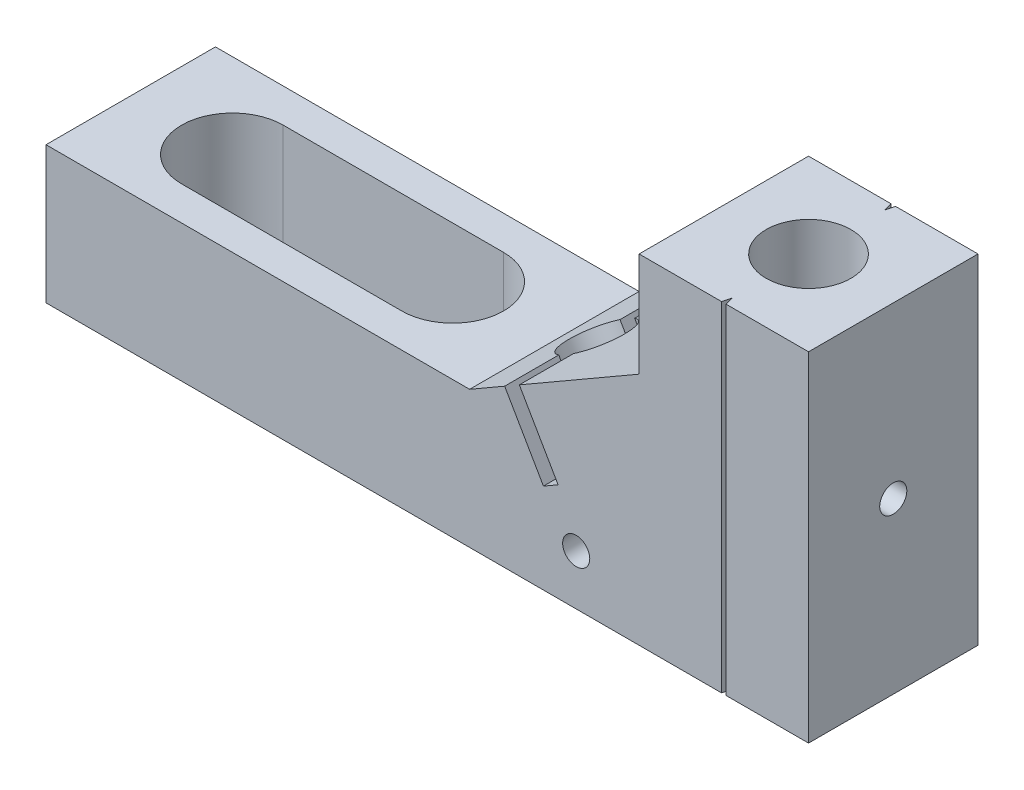
from build123d import *

# Parameters (mm, degrees)
SKETCH1_W                 = 20
SKETCH1_H                 = 10
BOSS_EXTRUDE1_DEPTH       = 20
SKETCH2_R                 = 2.5
CUT_EXTRUDE1_DEPTH        = 26.836409614
CUT_EXTRUDE2_DEPTH        = 27.191969955
SKETCH5_R                 = 1.875
CUT_EXTRUDE5_DEPTH        = 21.021203074
M2X0_4_TAPPED_HOLE1_D     = 1.6
M2X0_4_TAPPED_HOLE1_DEPTH = 6
M2X0_4_TAPPED_HOLE1_TIP   = 0.480688495
M2X0_4_TAPPED_HOLE2_D     = 1.6
M2X0_4_TAPPED_HOLE2_DEPTH = 6
M2X0_4_TAPPED_HOLE2_TIP   = 0.480688495
SKETCH14_W                = 10
SKETCH14_H                = 8.082903769
BOSS_EXTRUDE3_DEPTH       = 25
CUT_EXTRUDE7_REACH        = 43.43


with BuildPart() as part:
    # Sketch1 → Boss-Extrude1 (new body)
    with BuildSketch(Plane(origin=(0, 0, 0), x_dir=(1, 0, 0), z_dir=(0, 1, 0))):
        with Locations((-3.638888889, 4.027777778)):
            Rectangle(SKETCH1_W, SKETCH1_H)
    extrude(amount=BOSS_EXTRUDE1_DEPTH)

    # Sketch2 → Cut-Extrude1 (cut, through all)
    with BuildSketch(Plane(origin=(0, 20, 0), x_dir=(1, 0, 0), z_dir=(0, 1, 0))):
        with Locations((1.361111111, 4.027777778)):
            Circle(SKETCH2_R)
        Polygon((1.495085707, -0.972222222), (1.361111111, -0.472222222), (1.227136515, -0.972222222), align=None)
        Polygon((1.361111111, 8.527777778), (1.227136515, 9.027777778), (1.495085707, 9.027777778), align=None)
    extrude(amount=-CUT_EXTRUDE1_DEPTH, mode=Mode.SUBTRACT)

    # Sketch3 → Cut-Extrude2 (cut, through all)
    with BuildSketch(Plane.XY.offset(0.972222222)):
        Polygon((-13.638888889, 20), (-3.638888889, 20), (-3.638888889, 13.856406461), (-10.705876187, 9.776279442), (-8.417376187, 5.812481169), (-9.283401591, 5.312481169), (-11.571901591, 9.276279442), (-13.638888889, 8.082903769), align=None)
    extrude(amount=-CUT_EXTRUDE2_DEPTH, mode=Mode.SUBTRACT)

    # Sketch5 → Cut-Extrude5 (cut, through all)
    with BuildSketch(Plane(origin=(-6.909722222, 11.967989955, 0), x_dir=(0.8660254037844415, 0.49999999999999534, 0), z_dir=(-0.49999999999999534, 0.8660254037844415, 0))):
        with Locations((-4.883421027, 4.027777778)):
            Circle(SKETCH5_R)
    extrude(amount=-CUT_EXTRUDE5_DEPTH, mode=Mode.SUBTRACT)

    # M2x0.4 Tapped Hole1
    with Locations(Plane(origin=(6.361111111, 0, 0), x_dir=(0, 0, -1), z_dir=(1, 0, 0))):
        with Locations((4.027777778, 10)):
            Hole(M2X0_4_TAPPED_HOLE1_D / 2, depth=M2X0_4_TAPPED_HOLE1_DEPTH)
            with Locations((0, 0, -(M2X0_4_TAPPED_HOLE1_DEPTH + M2X0_4_TAPPED_HOLE1_TIP / 2))):  # 118° drill point
                Cone(0, M2X0_4_TAPPED_HOLE1_D / 2, M2X0_4_TAPPED_HOLE1_TIP, mode=Mode.SUBTRACT)

    # M2x0.4 Tapped Hole2
    with Locations(Plane.XY.offset(0.972222222)):
        with Locations((-7.350388889, 2.964404957)):
            Hole(M2X0_4_TAPPED_HOLE2_D / 2, depth=M2X0_4_TAPPED_HOLE2_DEPTH)
            with Locations((0, 0, -(M2X0_4_TAPPED_HOLE2_DEPTH + M2X0_4_TAPPED_HOLE2_TIP / 2))):  # 118° drill point
                Cone(0, M2X0_4_TAPPED_HOLE2_D / 2, M2X0_4_TAPPED_HOLE2_TIP, mode=Mode.SUBTRACT)

    # Sketch14 → Boss-Extrude3 (add)
    with BuildSketch(Plane.ZY.offset(13.638888889)):
        with Locations((-4.027777778, 4.041451884)):
            Rectangle(SKETCH14_W, SKETCH14_H)
    extrude(amount=BOSS_EXTRUDE3_DEPTH)

    # Sketch15 → Cut-Extrude7 (cut, up to next)
    with BuildSketch(Plane(origin=(0, 8.082903769, 0), x_dir=(1, 0, 0), z_dir=(0, 1, 0)), mode=Mode.PRIVATE) as cut_extrude7_sk1:
        with BuildLine():
            Line((-19.638888889, 1.027777778), (-32.638888889, 1.027777778))
            ThreePointArc((-32.638888889, 1.027777778), (-35.638888889, 4.027777778), (-32.638888889, 7.027777778))
            Line((-32.638888889, 7.027777778), (-19.638888889, 7.027777778))
            ThreePointArc((-19.638888889, 7.027777778), (-16.638888889, 4.027777778), (-19.638888889, 1.027777778))
        make_face()
    cut_extrude7_tool1 = extrude(cut_extrude7_sk1.sketch, amount=-CUT_EXTRUDE7_REACH, mode=Mode.PRIVATE) & part.part
    add(cut_extrude7_tool1.solids().sort_by_distance((-26.138889, 8.082904, -4.027778))[0], mode=Mode.SUBTRACT)


solid = part.part
